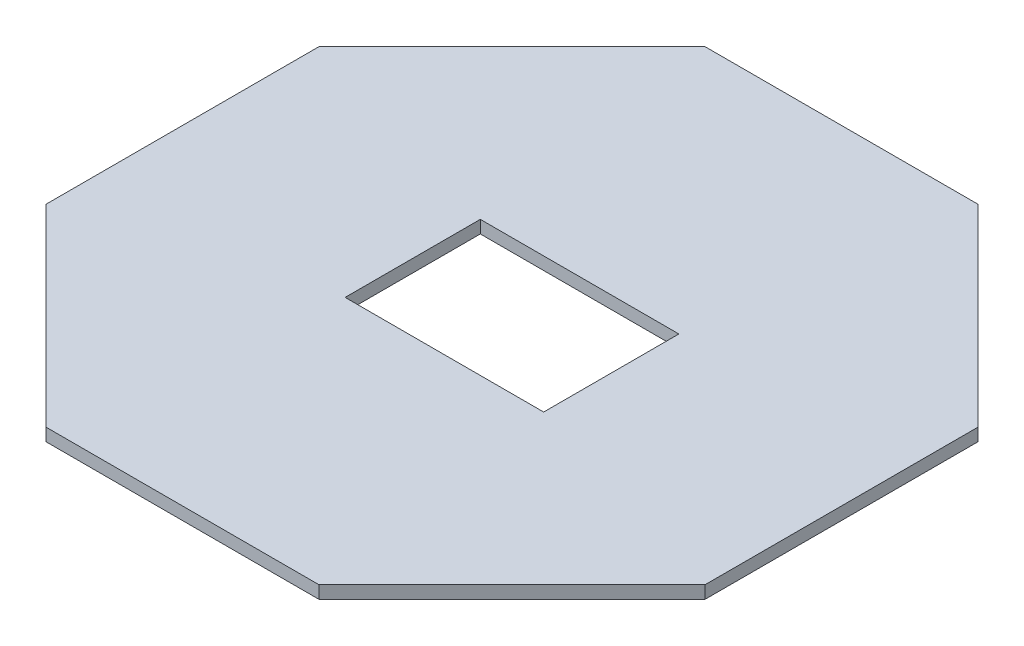
from build123d import *

# Parameters (mm, degrees)
BOSS_EXTRUDE5_DEPTH = 3
SKETCH9_W           = 47
SKETCH9_H           = 32
CUT_EXTRUDE1_DEPTH  = 3


with BuildPart() as part:
    # Sketch6 → Boss-Extrude5 (new body)
    with BuildSketch(Plane(origin=(0, 0, 0), x_dir=(1, 0, 0), z_dir=(0, 1, 0))):
        Polygon((78, 32.308657865), (32.308657865, 78), (-32.308657865, 78), (-78, 32.308657865), (-78, -32.308657865), (-32.308657865, -78), (32.308657865, -78), (78, -32.308657865), align=None)
    extrude(amount=-BOSS_EXTRUDE5_DEPTH)

    # Sketch9 → Cut-Extrude1 (cut)
    with BuildSketch(Plane(origin=(0, 0, 0), x_dir=(1, 0, 0), z_dir=(0, 1, 0))):
        Rectangle(SKETCH9_W, SKETCH9_H)
    extrude(amount=-CUT_EXTRUDE1_DEPTH, mode=Mode.SUBTRACT)


solid = part.part
